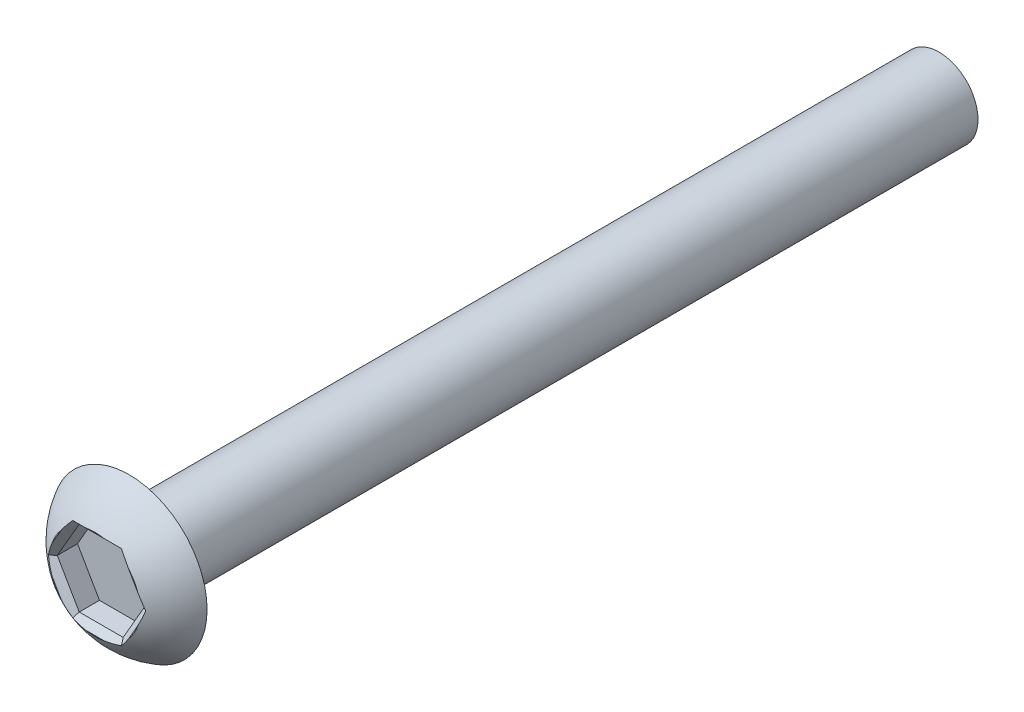
from build123d import *

# Parameters (mm, degrees)
SKETCH1_R               = 1.25
BOSS_EXTRUDE1_DEPTH     = 26
CUT_EXTRUDE1_DEPTH      = 1.25
CUT_EXTRUDE2_DEPTH      = 27.239283527
CUT_EXTRUDE2_DEPTH_BACK = 27.239283527
SKETCH6_W               = 1.249656436
SKETCH6_H               = 4.384153796
CHAMFER2_SIZE           = 0.2


with BuildPart() as part:
    # Sketch1 → Boss-Extrude1 (new body)
    with BuildSketch(Plane.XY):
        Circle(SKETCH1_R)
    extrude(amount=-BOSS_EXTRUDE1_DEPTH)

    # Sketch3 → Revolve1 (revolve)
    with BuildSketch(Plane(origin=(0, 0, 0), x_dir=(0, 0, -1), z_dir=(1, 0, 0)), mode=Mode.PRIVATE) as revolve1_sk:
        with BuildLine():
            ThreePointArc((-1.5, 0), (-1.096229956, 1.457737974), (0, 2.5))
            Line((0, 2.5), (0, 0))
            Line((0, 0), (-1.5, 0))
        make_face()
    revolve(revolve1_sk.sketch.rotate(Axis((0, 0, 1.5), (0, 0, -1)), 180), axis=Axis((0, 0, 1.5), (0, 0, -1)))

    # Sketch5 → Cut-Extrude1 (cut)
    with BuildSketch(Plane(origin=(0, 0, 1.5), x_dir=(-1, 0, 0), z_dir=(0, 0, -1))):
        Polygon((-1.409901945, 0), (-0.704950973, -1.221010901), (0.704950973, -1.221010901), (1.409901945, 0), (0.704950973, 1.221010901), (-0.704950973, 1.221010901), align=None)
    extrude(amount=CUT_EXTRUDE1_DEPTH, mode=Mode.SUBTRACT)

    # Sketch6 → Cut-Extrude2 (cut, two sides: drawn at the far end of the back side and taken through both)
    with BuildSketch(Plane(origin=(0, 0, 0), x_dir=(0, 0, -1), z_dir=(1, 0, 0)).offset(-CUT_EXTRUDE2_DEPTH_BACK)):
        with Locations((-1.724828218, 0.205450463)):
            Rectangle(SKETCH6_W, SKETCH6_H)
    extrude(amount=CUT_EXTRUDE2_DEPTH + CUT_EXTRUDE2_DEPTH_BACK, mode=Mode.SUBTRACT)

    # Chamfer2
    # the kernel refuses this chamfer: 0.2 mm, written as the material it takes off along each edge
    with BuildSketch(Plane(origin=(1.21928757, 1.221010901, 1.1), x_dir=(1.0390370186618431e-14, 0.9996219169112966, 0.02749587661058733), z_dir=(-1, 0, 0))) as chamfer2_piece_1_section:
        Polygon((CHAMFER2_SIZE * 0.999621916911, CHAMFER2_SIZE * 0.0274958766106), (-CHAMFER2_SIZE * 0.0274958766106, CHAMFER2_SIZE * 0.999621916911), (0, 0), align=None)
    chamfer2_piece_1 = extrude(amount=2.43857514, mode=Mode.PRIVATE)
    chamfer2_piece_1 = split(chamfer2_piece_1, bisect_by=Plane(origin=(0.501104512, 1.574083329, 1.032865614), z_dir=(-0.8660254037844416, -0.49999999999999495, 0)), keep=Keep.TOP, mode=Mode.PRIVATE)
    chamfer2_piece_1 = split(chamfer2_piece_1, bisect_by=Plane(origin=(-0.501104512, 1.574083329, 1.032865614), z_dir=(0.8660254037844347, -0.500000000000007, 0)), keep=Keep.TOP, mode=Mode.PRIVATE)
    add(chamfer2_piece_1, mode=Mode.SUBTRACT)
    with BuildSketch(Plane(origin=(1.667070244, -0.44542856, 1.1), x_dir=(0.8656979742248833, 0.4998109584556433, 0.027495876610586282), z_dir=(-0.49999999999999495, 0.8660254037844416, 0))) as chamfer2_piece_2_section:
        Polygon((CHAMFER2_SIZE * 0.999621916911, CHAMFER2_SIZE * 0.0274958766106), (-CHAMFER2_SIZE * 0.0274958766106, CHAMFER2_SIZE * 0.999621916911), (0, 0), align=None)
    chamfer2_piece_2 = extrude(amount=2.43857514, mode=Mode.PRIVATE)
    chamfer2_piece_2 = split(chamfer2_piece_2, bisect_by=Plane(origin=(1.613748406, 0.353072427, 1.032865614), z_dir=(-0.8660254037844382, 0.500000000000001, 0)), keep=Keep.TOP, mode=Mode.PRIVATE)
    chamfer2_piece_2 = split(chamfer2_piece_2, bisect_by=Plane(origin=(1.112643894, 1.221010901, 1.032865614), z_dir=(0, -1, 0)), keep=Keep.TOP, mode=Mode.PRIVATE)
    add(chamfer2_piece_2, mode=Mode.SUBTRACT)
    with BuildSketch(Plane(origin=(0.447782674, -1.666439461, 1.1), x_dir=(0.8656979742248797, -0.4998109584556493, 0.02749587661058626), z_dir=(0.500000000000001, 0.8660254037844382, 0))) as chamfer2_piece_3_section:
        Polygon((CHAMFER2_SIZE * 0.999621916911, CHAMFER2_SIZE * 0.0274958766106), (-CHAMFER2_SIZE * 0.0274958766106, CHAMFER2_SIZE * 0.999621916911), (0, 0), align=None)
    chamfer2_piece_3 = extrude(amount=2.43857514, mode=Mode.PRIVATE)
    chamfer2_piece_3 = split(chamfer2_piece_3, bisect_by=Plane(origin=(1.112643894, -1.221010901, 1.032865614), z_dir=(0, 1, 0)), keep=Keep.TOP, mode=Mode.PRIVATE)
    chamfer2_piece_3 = split(chamfer2_piece_3, bisect_by=Plane(origin=(1.613748406, -0.353072427, 1.032865614), z_dir=(-0.8660254037844416, -0.49999999999999495, 0)), keep=Keep.TOP, mode=Mode.PRIVATE)
    add(chamfer2_piece_3, mode=Mode.SUBTRACT)
    with BuildSketch(Plane(origin=(-1.21928757, -1.221010901, 1.1), x_dir=(-3.30602687756041e-15, -0.9996219169112968, 0.027495876610586285), z_dir=(1, 0, 0))) as chamfer2_piece_4_section:
        Polygon((CHAMFER2_SIZE * 0.999621916911, CHAMFER2_SIZE * 0.0274958766106), (-CHAMFER2_SIZE * 0.0274958766106, CHAMFER2_SIZE * 0.999621916911), (0, 0), align=None)
    chamfer2_piece_4 = extrude(amount=2.43857514, mode=Mode.PRIVATE)
    chamfer2_piece_4 = split(chamfer2_piece_4, bisect_by=Plane(origin=(-0.501104512, -1.574083329, 1.032865614), z_dir=(0.8660254037844417, 0.49999999999999484, 0)), keep=Keep.TOP, mode=Mode.PRIVATE)
    chamfer2_piece_4 = split(chamfer2_piece_4, bisect_by=Plane(origin=(0.501104512, -1.574083329, 1.032865614), z_dir=(-0.8660254037844382, 0.500000000000001, 0)), keep=Keep.TOP, mode=Mode.PRIVATE)
    add(chamfer2_piece_4, mode=Mode.SUBTRACT)
    with BuildSketch(Plane(origin=(-1.667070244, 0.44542856, 1.1), x_dir=(-0.8656979742248834, -0.4998109584556432, 0.027495876610586265), z_dir=(0.49999999999999484, -0.8660254037844417, 0))) as chamfer2_piece_5_section:
        Polygon((CHAMFER2_SIZE * 0.999621916911, CHAMFER2_SIZE * 0.0274958766106), (-CHAMFER2_SIZE * 0.0274958766106, CHAMFER2_SIZE * 0.999621916911), (0, 0), align=None)
    chamfer2_piece_5 = extrude(amount=2.43857514, mode=Mode.PRIVATE)
    chamfer2_piece_5 = split(chamfer2_piece_5, bisect_by=Plane(origin=(-1.112643894, -1.221010901, 1.032865614), z_dir=(0, 1, 0)), keep=Keep.TOP, mode=Mode.PRIVATE)
    chamfer2_piece_5 = split(chamfer2_piece_5, bisect_by=Plane(origin=(-1.613748406, -0.353072427, 1.032865614), z_dir=(0.8660254037844347, -0.500000000000007, 0)), keep=Keep.TOP, mode=Mode.PRIVATE)
    add(chamfer2_piece_5, mode=Mode.SUBTRACT)
    with BuildSketch(Plane(origin=(-0.447782674, 1.666439461, 1.1), x_dir=(-0.8656979742248764, 0.4998109584556554, 0.027495876610586265), z_dir=(-0.500000000000007, -0.8660254037844347, 0))) as chamfer2_piece_6_section:
        Polygon((CHAMFER2_SIZE * 0.999621916911, CHAMFER2_SIZE * 0.0274958766106), (-CHAMFER2_SIZE * 0.0274958766106, CHAMFER2_SIZE * 0.999621916911), (0, 0), align=None)
    chamfer2_piece_6 = extrude(amount=2.43857514, mode=Mode.PRIVATE)
    chamfer2_piece_6 = split(chamfer2_piece_6, bisect_by=Plane(origin=(-1.112643894, 1.221010901, 1.032865614), z_dir=(0, -1, 0)), keep=Keep.TOP, mode=Mode.PRIVATE)
    chamfer2_piece_6 = split(chamfer2_piece_6, bisect_by=Plane(origin=(-1.613748406, 0.353072427, 1.032865614), z_dir=(0.8660254037844417, 0.49999999999999484, 0)), keep=Keep.TOP, mode=Mode.PRIVATE)
    add(chamfer2_piece_6, mode=Mode.SUBTRACT)
    with BuildSketch(Plane(origin=(1.667070244, -0.44542856, 1.1), x_dir=(0.8656979742248833, 0.4998109584556433, 0.027495876610586282), z_dir=(-0.49999999999999495, 0.8660254037844416, 0))) as chamfer2_piece_7a_section:
        Polygon((CHAMFER2_SIZE * 0.999621916911, CHAMFER2_SIZE * 0.0274958766106), (-CHAMFER2_SIZE * 0.0274958766106, CHAMFER2_SIZE * 0.999621916911), (0, 0), align=None)
    chamfer2_piece_7a = extrude(amount=2.43857514, mode=Mode.PRIVATE)
    chamfer2_piece_7a = split(chamfer2_piece_7a, bisect_by=Plane(origin=(0.645691333, 1.221010901, 1.035460513), z_dir=(0, 1, 0)), keep=Keep.TOP, mode=Mode.PRIVATE)
    with BuildSketch(Plane(origin=(1.21928757, 1.221010901, 1.1), x_dir=(1.0390370186618431e-14, 0.9996219169112966, 0.02749587661058733), z_dir=(-1, 0, 0))) as chamfer2_piece_7b_section:
        Polygon((CHAMFER2_SIZE * 0.999621916911, CHAMFER2_SIZE * 0.0274958766106), (-CHAMFER2_SIZE * 0.0274958766106, CHAMFER2_SIZE * 0.999621916911), (0, 0), align=None)
    chamfer2_piece_7b = extrude(amount=2.43857514, mode=Mode.PRIVATE)
    chamfer2_piece_7b = split(chamfer2_piece_7b, bisect_by=Plane(origin=(0.734580793, 1.169690548, 1.035460513), z_dir=(0.8660254037844416, 0.49999999999999495, 0)), keep=Keep.TOP, mode=Mode.PRIVATE)
    chamfer2_piece_7 = chamfer2_piece_7a & chamfer2_piece_7b
    add(chamfer2_piece_7, mode=Mode.SUBTRACT)
    with BuildSketch(Plane(origin=(1.21928757, 1.221010901, 1.1), x_dir=(1.0390370186618431e-14, 0.9996219169112966, 0.02749587661058733), z_dir=(-1, 0, 0))) as chamfer2_piece_8a_section:
        Polygon((CHAMFER2_SIZE * 0.999621916911, CHAMFER2_SIZE * 0.0274958766106), (-CHAMFER2_SIZE * 0.0274958766106, CHAMFER2_SIZE * 0.999621916911), (0, 0), align=None)
    chamfer2_piece_8a = extrude(amount=2.43857514, mode=Mode.PRIVATE)
    chamfer2_piece_8a = split(chamfer2_piece_8a, bisect_by=Plane(origin=(-0.734580793, 1.169690548, 1.035460513), z_dir=(-0.8660254037844347, 0.500000000000007, 0)), keep=Keep.TOP, mode=Mode.PRIVATE)
    with BuildSketch(Plane(origin=(-0.447782674, 1.666439461, 1.1), x_dir=(-0.8656979742248764, 0.4998109584556554, 0.027495876610586265), z_dir=(-0.500000000000007, -0.8660254037844347, 0))) as chamfer2_piece_8b_section:
        Polygon((CHAMFER2_SIZE * 0.999621916911, CHAMFER2_SIZE * 0.0274958766106), (-CHAMFER2_SIZE * 0.0274958766106, CHAMFER2_SIZE * 0.999621916911), (0, 0), align=None)
    chamfer2_piece_8b = extrude(amount=2.43857514, mode=Mode.PRIVATE)
    chamfer2_piece_8b = split(chamfer2_piece_8b, bisect_by=Plane(origin=(-0.645691333, 1.221010901, 1.035460513), z_dir=(0, 1, 0)), keep=Keep.TOP, mode=Mode.PRIVATE)
    chamfer2_piece_8 = chamfer2_piece_8a & chamfer2_piece_8b
    add(chamfer2_piece_8, mode=Mode.SUBTRACT)
    with BuildSketch(Plane(origin=(0.447782674, -1.666439461, 1.1), x_dir=(0.8656979742248797, -0.4998109584556493, 0.02749587661058626), z_dir=(0.500000000000001, 0.8660254037844382, 0))) as chamfer2_piece_9a_section:
        Polygon((CHAMFER2_SIZE * 0.999621916911, CHAMFER2_SIZE * 0.0274958766106), (-CHAMFER2_SIZE * 0.0274958766106, CHAMFER2_SIZE * 0.999621916911), (0, 0), align=None)
    chamfer2_piece_9a = extrude(amount=2.43857514, mode=Mode.PRIVATE)
    chamfer2_piece_9a = split(chamfer2_piece_9a, bisect_by=Plane(origin=(1.380272125, 0.051320354, 1.035460513), z_dir=(0.8660254037844416, 0.49999999999999495, 0)), keep=Keep.TOP, mode=Mode.PRIVATE)
    with BuildSketch(Plane(origin=(1.667070244, -0.44542856, 1.1), x_dir=(0.8656979742248833, 0.4998109584556433, 0.027495876610586282), z_dir=(-0.49999999999999495, 0.8660254037844416, 0))) as chamfer2_piece_9b_section:
        Polygon((CHAMFER2_SIZE * 0.999621916911, CHAMFER2_SIZE * 0.0274958766106), (-CHAMFER2_SIZE * 0.0274958766106, CHAMFER2_SIZE * 0.999621916911), (0, 0), align=None)
    chamfer2_piece_9b = extrude(amount=2.43857514, mode=Mode.PRIVATE)
    chamfer2_piece_9b = split(chamfer2_piece_9b, bisect_by=Plane(origin=(1.380272125, -0.051320354, 1.035460513), z_dir=(0.8660254037844382, -0.500000000000001, 0)), keep=Keep.TOP, mode=Mode.PRIVATE)
    chamfer2_piece_9 = chamfer2_piece_9a & chamfer2_piece_9b
    add(chamfer2_piece_9, mode=Mode.SUBTRACT)
    with BuildSketch(Plane(origin=(-1.21928757, -1.221010901, 1.1), x_dir=(-3.30602687756041e-15, -0.9996219169112968, 0.027495876610586285), z_dir=(1, 0, 0))) as chamfer2_piece_10a_section:
        Polygon((CHAMFER2_SIZE * 0.999621916911, CHAMFER2_SIZE * 0.0274958766106), (-CHAMFER2_SIZE * 0.0274958766106, CHAMFER2_SIZE * 0.999621916911), (0, 0), align=None)
    chamfer2_piece_10a = extrude(amount=2.43857514, mode=Mode.PRIVATE)
    chamfer2_piece_10a = split(chamfer2_piece_10a, bisect_by=Plane(origin=(0.734580793, -1.169690548, 1.035460513), z_dir=(0.8660254037844382, -0.500000000000001, 0)), keep=Keep.TOP, mode=Mode.PRIVATE)
    with BuildSketch(Plane(origin=(0.447782674, -1.666439461, 1.1), x_dir=(0.8656979742248797, -0.4998109584556493, 0.02749587661058626), z_dir=(0.500000000000001, 0.8660254037844382, 0))) as chamfer2_piece_10b_section:
        Polygon((CHAMFER2_SIZE * 0.999621916911, CHAMFER2_SIZE * 0.0274958766106), (-CHAMFER2_SIZE * 0.0274958766106, CHAMFER2_SIZE * 0.999621916911), (0, 0), align=None)
    chamfer2_piece_10b = extrude(amount=2.43857514, mode=Mode.PRIVATE)
    chamfer2_piece_10b = split(chamfer2_piece_10b, bisect_by=Plane(origin=(0.645691333, -1.221010901, 1.035460513), z_dir=(0, -1, 0)), keep=Keep.TOP, mode=Mode.PRIVATE)
    chamfer2_piece_10 = chamfer2_piece_10a & chamfer2_piece_10b
    add(chamfer2_piece_10, mode=Mode.SUBTRACT)
    with BuildSketch(Plane(origin=(-1.21928757, -1.221010901, 1.1), x_dir=(-3.30602687756041e-15, -0.9996219169112968, 0.027495876610586285), z_dir=(1, 0, 0))) as chamfer2_piece_11a_section:
        Polygon((CHAMFER2_SIZE * 0.999621916911, CHAMFER2_SIZE * 0.0274958766106), (-CHAMFER2_SIZE * 0.0274958766106, CHAMFER2_SIZE * 0.999621916911), (0, 0), align=None)
    chamfer2_piece_11a = extrude(amount=2.43857514, mode=Mode.PRIVATE)
    chamfer2_piece_11a = split(chamfer2_piece_11a, bisect_by=Plane(origin=(-0.734580793, -1.169690548, 1.035460513), z_dir=(-0.8660254037844417, -0.49999999999999484, 0)), keep=Keep.TOP, mode=Mode.PRIVATE)
    with BuildSketch(Plane(origin=(-1.667070244, 0.44542856, 1.1), x_dir=(-0.8656979742248834, -0.4998109584556432, 0.027495876610586265), z_dir=(0.49999999999999484, -0.8660254037844417, 0))) as chamfer2_piece_11b_section:
        Polygon((CHAMFER2_SIZE * 0.999621916911, CHAMFER2_SIZE * 0.0274958766106), (-CHAMFER2_SIZE * 0.0274958766106, CHAMFER2_SIZE * 0.999621916911), (0, 0), align=None)
    chamfer2_piece_11b = extrude(amount=2.43857514, mode=Mode.PRIVATE)
    chamfer2_piece_11b = split(chamfer2_piece_11b, bisect_by=Plane(origin=(-0.645691333, -1.221010901, 1.035460513), z_dir=(0, -1, 0)), keep=Keep.TOP, mode=Mode.PRIVATE)
    chamfer2_piece_11 = chamfer2_piece_11a & chamfer2_piece_11b
    add(chamfer2_piece_11, mode=Mode.SUBTRACT)
    with BuildSketch(Plane(origin=(-0.447782674, 1.666439461, 1.1), x_dir=(-0.8656979742248764, 0.4998109584556554, 0.027495876610586265), z_dir=(-0.500000000000007, -0.8660254037844347, 0))) as chamfer2_piece_12a_section:
        Polygon((CHAMFER2_SIZE * 0.999621916911, CHAMFER2_SIZE * 0.0274958766106), (-CHAMFER2_SIZE * 0.0274958766106, CHAMFER2_SIZE * 0.999621916911), (0, 0), align=None)
    chamfer2_piece_12a = extrude(amount=2.43857514, mode=Mode.PRIVATE)
    chamfer2_piece_12a = split(chamfer2_piece_12a, bisect_by=Plane(origin=(-1.380272125, -0.051320354, 1.035460513), z_dir=(-0.8660254037844417, -0.49999999999999484, 0)), keep=Keep.TOP, mode=Mode.PRIVATE)
    with BuildSketch(Plane(origin=(-1.667070244, 0.44542856, 1.1), x_dir=(-0.8656979742248834, -0.4998109584556432, 0.027495876610586265), z_dir=(0.49999999999999484, -0.8660254037844417, 0))) as chamfer2_piece_12b_section:
        Polygon((CHAMFER2_SIZE * 0.999621916911, CHAMFER2_SIZE * 0.0274958766106), (-CHAMFER2_SIZE * 0.0274958766106, CHAMFER2_SIZE * 0.999621916911), (0, 0), align=None)
    chamfer2_piece_12b = extrude(amount=2.43857514, mode=Mode.PRIVATE)
    chamfer2_piece_12b = split(chamfer2_piece_12b, bisect_by=Plane(origin=(-1.380272125, 0.051320354, 1.035460513), z_dir=(-0.8660254037844347, 0.500000000000007, 0)), keep=Keep.TOP, mode=Mode.PRIVATE)
    chamfer2_piece_12 = chamfer2_piece_12a & chamfer2_piece_12b
    add(chamfer2_piece_12, mode=Mode.SUBTRACT)


solid = part.part
